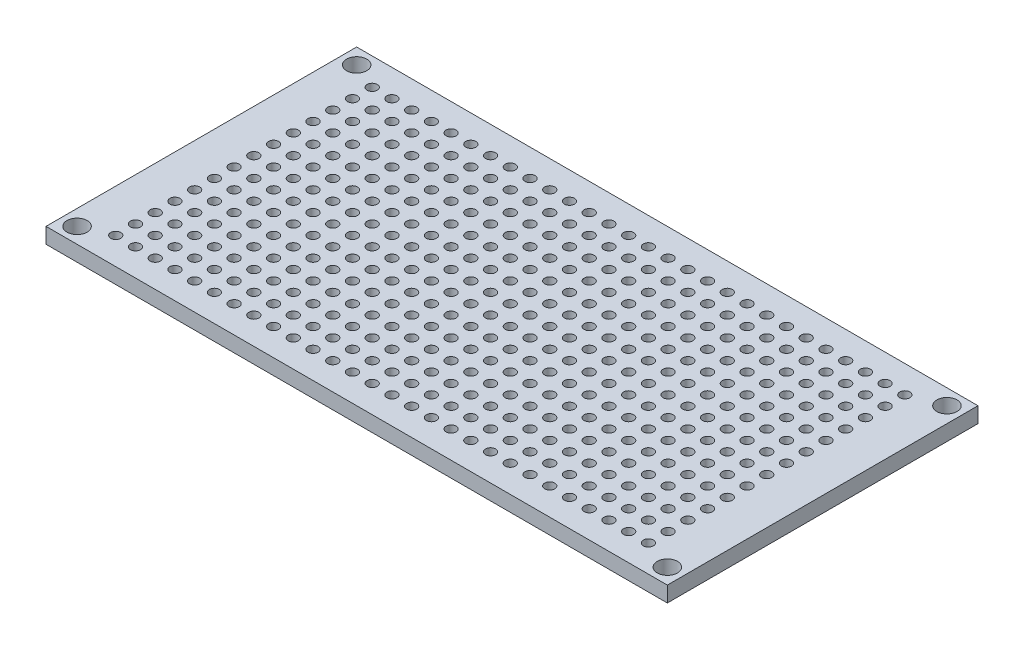
from build123d import *

# Parameters (mm, degrees)
SKETCH_1_W                 = 80
SKETCH_1_H                 = 40
EXTRUDE_1_DEPTH            = 2
HOLE_WIZARD_M21_D          = 2.6
HOLE_WIZARD_M11_D          = 1.3
PATTERN_LINEAR_1_OUTLINE_R = 0.65
PATTERN_LINEAR_1_DEPTH     = 2


# Read off the part's stored shape, not the designer's step: Линейный массив1
with BuildPart() as part:
    # Эскиз1 → Бобышка-Вытянуть1 (new body)
    with BuildSketch(Plane(origin=(0, 0, 0), x_dir=(1, 0, 0), z_dir=(0, 1, 0))):
        Rectangle(SKETCH_1_W, SKETCH_1_H)
    extrude(amount=EXTRUDE_1_DEPTH)

    # Отверстие с зазором M21 (through all)
    with Locations(Plane(origin=(0, 2, 0), x_dir=(1, 0, 0), z_dir=(0, 1, 0))):
        with Locations((-38, 18), (38, 18), (38, -18), (-38, -18)):
            Hole(HOLE_WIZARD_M21_D / 2)

    # Отверстие с зазором M11 (through all)
    with Locations(Plane(origin=(0, 2, 0), x_dir=(1, 0, 0), z_dir=(0, 1, 0))):
        with Locations((-34.5, 16.5)):
            Hole(HOLE_WIZARD_M11_D / 2)

    # Линейный массив1 outline → Линейный массив1 (cut)
    with BuildSketch(Plane(origin=(0, 0, 0), x_dir=(1, 0, 0), z_dir=(0, 1, 0))):
        with Locations((34.08, -16.52)):
            Circle(PATTERN_LINEAR_1_OUTLINE_R)
        with Locations((31.54, -16.52)):
            Circle(PATTERN_LINEAR_1_OUTLINE_R)
        with Locations((29, -16.52)):
            Circle(PATTERN_LINEAR_1_OUTLINE_R)
        with Locations((26.46, -16.52)):
            Circle(PATTERN_LINEAR_1_OUTLINE_R)
        with Locations((23.92, -16.52)):
            Circle(PATTERN_LINEAR_1_OUTLINE_R)
        with Locations((21.38, -16.52)):
            Circle(PATTERN_LINEAR_1_OUTLINE_R)
        with Locations((18.84, -16.52)):
            Circle(PATTERN_LINEAR_1_OUTLINE_R)
        with Locations((16.3, -16.52)):
            Circle(PATTERN_LINEAR_1_OUTLINE_R)
        with Locations((13.76, -16.52)):
            Circle(PATTERN_LINEAR_1_OUTLINE_R)
        with Locations((11.22, -16.52)):
            Circle(PATTERN_LINEAR_1_OUTLINE_R)
        with Locations((8.68, -16.52)):
            Circle(PATTERN_LINEAR_1_OUTLINE_R)
        with Locations((6.14, -16.52)):
            Circle(PATTERN_LINEAR_1_OUTLINE_R)
        with Locations((3.6, -16.52)):
            Circle(PATTERN_LINEAR_1_OUTLINE_R)
        with Locations((1.06, -16.52)):
            Circle(PATTERN_LINEAR_1_OUTLINE_R)
        with Locations((-1.48, -16.52)):
            Circle(PATTERN_LINEAR_1_OUTLINE_R)
        with Locations((-4.02, -16.52)):
            Circle(PATTERN_LINEAR_1_OUTLINE_R)
        with Locations((-6.56, -16.52)):
            Circle(PATTERN_LINEAR_1_OUTLINE_R)
        with Locations((-9.1, -16.52)):
            Circle(PATTERN_LINEAR_1_OUTLINE_R)
        with Locations((-11.64, -16.52)):
            Circle(PATTERN_LINEAR_1_OUTLINE_R)
        with Locations((-14.18, -16.52)):
            Circle(PATTERN_LINEAR_1_OUTLINE_R)
        with Locations((-16.72, -16.52)):
            Circle(PATTERN_LINEAR_1_OUTLINE_R)
        with Locations((-19.26, -16.52)):
            Circle(PATTERN_LINEAR_1_OUTLINE_R)
        with Locations((-21.8, -16.52)):
            Circle(PATTERN_LINEAR_1_OUTLINE_R)
        with Locations((-24.34, -16.52)):
            Circle(PATTERN_LINEAR_1_OUTLINE_R)
        with Locations((-26.88, -16.52)):
            Circle(PATTERN_LINEAR_1_OUTLINE_R)
        with Locations((-29.42, -16.52)):
            Circle(PATTERN_LINEAR_1_OUTLINE_R)
        with Locations((-31.96, -16.52)):
            Circle(PATTERN_LINEAR_1_OUTLINE_R)
        with Locations((-34.5, -16.52)):
            Circle(PATTERN_LINEAR_1_OUTLINE_R)
        with Locations((34.08, -13.98)):
            Circle(PATTERN_LINEAR_1_OUTLINE_R)
        with Locations((-34.5, -13.98)):
            Circle(PATTERN_LINEAR_1_OUTLINE_R)
        with Locations((34.08, -11.44)):
            Circle(PATTERN_LINEAR_1_OUTLINE_R)
        with Locations((-34.5, -11.44)):
            Circle(PATTERN_LINEAR_1_OUTLINE_R)
        with Locations((34.08, -8.9)):
            Circle(PATTERN_LINEAR_1_OUTLINE_R)
        with Locations((-34.5, -8.9)):
            Circle(PATTERN_LINEAR_1_OUTLINE_R)
        with Locations((34.08, -6.36)):
            Circle(PATTERN_LINEAR_1_OUTLINE_R)
        with Locations((-34.5, -6.36)):
            Circle(PATTERN_LINEAR_1_OUTLINE_R)
        with Locations((34.08, -3.82)):
            Circle(PATTERN_LINEAR_1_OUTLINE_R)
        with Locations((-34.5, -3.82)):
            Circle(PATTERN_LINEAR_1_OUTLINE_R)
        with Locations((34.08, -1.28)):
            Circle(PATTERN_LINEAR_1_OUTLINE_R)
        with Locations((-34.5, -1.28)):
            Circle(PATTERN_LINEAR_1_OUTLINE_R)
        with Locations((34.08, 1.26)):
            Circle(PATTERN_LINEAR_1_OUTLINE_R)
        with Locations((-34.5, 1.26)):
            Circle(PATTERN_LINEAR_1_OUTLINE_R)
        with Locations((34.08, 3.8)):
            Circle(PATTERN_LINEAR_1_OUTLINE_R)
        with Locations((-34.5, 3.8)):
            Circle(PATTERN_LINEAR_1_OUTLINE_R)
        with Locations((34.08, 6.34)):
            Circle(PATTERN_LINEAR_1_OUTLINE_R)
        with Locations((-34.5, 6.34)):
            Circle(PATTERN_LINEAR_1_OUTLINE_R)
        with Locations((34.08, 8.88)):
            Circle(PATTERN_LINEAR_1_OUTLINE_R)
        with Locations((-34.5, 8.88)):
            Circle(PATTERN_LINEAR_1_OUTLINE_R)
        with Locations((34.08, 11.42)):
            Circle(PATTERN_LINEAR_1_OUTLINE_R)
        with Locations((-34.5, 11.42)):
            Circle(PATTERN_LINEAR_1_OUTLINE_R)
        with Locations((34.08, 13.96)):
            Circle(PATTERN_LINEAR_1_OUTLINE_R)
        with Locations((-34.5, 13.96)):
            Circle(PATTERN_LINEAR_1_OUTLINE_R)
        with Locations((34.08, 16.5)):
            Circle(PATTERN_LINEAR_1_OUTLINE_R)
        with Locations((31.54, 16.5)):
            Circle(PATTERN_LINEAR_1_OUTLINE_R)
        with Locations((29, 16.5)):
            Circle(PATTERN_LINEAR_1_OUTLINE_R)
        with Locations((26.46, 16.5)):
            Circle(PATTERN_LINEAR_1_OUTLINE_R)
        with Locations((23.92, 16.5)):
            Circle(PATTERN_LINEAR_1_OUTLINE_R)
        with Locations((21.38, 16.5)):
            Circle(PATTERN_LINEAR_1_OUTLINE_R)
        with Locations((18.84, 16.5)):
            Circle(PATTERN_LINEAR_1_OUTLINE_R)
        with Locations((16.3, 16.5)):
            Circle(PATTERN_LINEAR_1_OUTLINE_R)
        with Locations((13.76, 16.5)):
            Circle(PATTERN_LINEAR_1_OUTLINE_R)
        with Locations((11.22, 16.5)):
            Circle(PATTERN_LINEAR_1_OUTLINE_R)
        with Locations((8.68, 16.5)):
            Circle(PATTERN_LINEAR_1_OUTLINE_R)
        with Locations((6.14, 16.5)):
            Circle(PATTERN_LINEAR_1_OUTLINE_R)
        with Locations((3.6, 16.5)):
            Circle(PATTERN_LINEAR_1_OUTLINE_R)
        with Locations((1.06, 16.5)):
            Circle(PATTERN_LINEAR_1_OUTLINE_R)
        with Locations((-1.48, 16.5)):
            Circle(PATTERN_LINEAR_1_OUTLINE_R)
        with Locations((-4.02, 16.5)):
            Circle(PATTERN_LINEAR_1_OUTLINE_R)
        with Locations((-6.56, 16.5)):
            Circle(PATTERN_LINEAR_1_OUTLINE_R)
        with Locations((-9.1, 16.5)):
            Circle(PATTERN_LINEAR_1_OUTLINE_R)
        with Locations((-11.64, 16.5)):
            Circle(PATTERN_LINEAR_1_OUTLINE_R)
        with Locations((-14.18, 16.5)):
            Circle(PATTERN_LINEAR_1_OUTLINE_R)
        with Locations((-16.72, 16.5)):
            Circle(PATTERN_LINEAR_1_OUTLINE_R)
        with Locations((-19.26, 16.5)):
            Circle(PATTERN_LINEAR_1_OUTLINE_R)
        with Locations((-21.8, 16.5)):
            Circle(PATTERN_LINEAR_1_OUTLINE_R)
        with Locations((-24.34, 16.5)):
            Circle(PATTERN_LINEAR_1_OUTLINE_R)
        with Locations((-26.88, 16.5)):
            Circle(PATTERN_LINEAR_1_OUTLINE_R)
        with Locations((-29.42, 16.5)):
            Circle(PATTERN_LINEAR_1_OUTLINE_R)
        with Locations((31.54, -13.98)):
            Circle(PATTERN_LINEAR_1_OUTLINE_R)
        with Locations((29, -13.98)):
            Circle(PATTERN_LINEAR_1_OUTLINE_R)
        with Locations((26.46, -13.98)):
            Circle(PATTERN_LINEAR_1_OUTLINE_R)
        with Locations((23.92, -13.98)):
            Circle(PATTERN_LINEAR_1_OUTLINE_R)
        with Locations((21.38, -13.98)):
            Circle(PATTERN_LINEAR_1_OUTLINE_R)
        with Locations((18.84, -13.98)):
            Circle(PATTERN_LINEAR_1_OUTLINE_R)
        with Locations((16.3, -13.98)):
            Circle(PATTERN_LINEAR_1_OUTLINE_R)
        with Locations((13.76, -13.98)):
            Circle(PATTERN_LINEAR_1_OUTLINE_R)
        with Locations((11.22, -13.98)):
            Circle(PATTERN_LINEAR_1_OUTLINE_R)
        with Locations((8.68, -13.98)):
            Circle(PATTERN_LINEAR_1_OUTLINE_R)
        with Locations((6.14, -13.98)):
            Circle(PATTERN_LINEAR_1_OUTLINE_R)
        with Locations((3.6, -13.98)):
            Circle(PATTERN_LINEAR_1_OUTLINE_R)
        with Locations((1.06, -13.98)):
            Circle(PATTERN_LINEAR_1_OUTLINE_R)
        with Locations((-1.48, -13.98)):
            Circle(PATTERN_LINEAR_1_OUTLINE_R)
        with Locations((-4.02, -13.98)):
            Circle(PATTERN_LINEAR_1_OUTLINE_R)
        with Locations((-6.56, -13.98)):
            Circle(PATTERN_LINEAR_1_OUTLINE_R)
        with Locations((-9.1, -13.98)):
            Circle(PATTERN_LINEAR_1_OUTLINE_R)
        with Locations((-11.64, -13.98)):
            Circle(PATTERN_LINEAR_1_OUTLINE_R)
        with Locations((-14.18, -13.98)):
            Circle(PATTERN_LINEAR_1_OUTLINE_R)
        with Locations((-16.72, -13.98)):
            Circle(PATTERN_LINEAR_1_OUTLINE_R)
        with Locations((-19.26, -13.98)):
            Circle(PATTERN_LINEAR_1_OUTLINE_R)
        with Locations((-21.8, -13.98)):
            Circle(PATTERN_LINEAR_1_OUTLINE_R)
        with Locations((-24.34, -13.98)):
            Circle(PATTERN_LINEAR_1_OUTLINE_R)
        with Locations((-26.88, -13.98)):
            Circle(PATTERN_LINEAR_1_OUTLINE_R)
        with Locations((-29.42, -13.98)):
            Circle(PATTERN_LINEAR_1_OUTLINE_R)
        with Locations((-31.96, -13.98)):
            Circle(PATTERN_LINEAR_1_OUTLINE_R)
        with Locations((31.54, -11.44)):
            Circle(PATTERN_LINEAR_1_OUTLINE_R)
        with Locations((29, -11.44)):
            Circle(PATTERN_LINEAR_1_OUTLINE_R)
        with Locations((26.46, -11.44)):
            Circle(PATTERN_LINEAR_1_OUTLINE_R)
        with Locations((23.92, -11.44)):
            Circle(PATTERN_LINEAR_1_OUTLINE_R)
        with Locations((21.38, -11.44)):
            Circle(PATTERN_LINEAR_1_OUTLINE_R)
        with Locations((18.84, -11.44)):
            Circle(PATTERN_LINEAR_1_OUTLINE_R)
        with Locations((16.3, -11.44)):
            Circle(PATTERN_LINEAR_1_OUTLINE_R)
        with Locations((13.76, -11.44)):
            Circle(PATTERN_LINEAR_1_OUTLINE_R)
        with Locations((11.22, -11.44)):
            Circle(PATTERN_LINEAR_1_OUTLINE_R)
        with Locations((8.68, -11.44)):
            Circle(PATTERN_LINEAR_1_OUTLINE_R)
        with Locations((6.14, -11.44)):
            Circle(PATTERN_LINEAR_1_OUTLINE_R)
        with Locations((3.6, -11.44)):
            Circle(PATTERN_LINEAR_1_OUTLINE_R)
        with Locations((1.06, -11.44)):
            Circle(PATTERN_LINEAR_1_OUTLINE_R)
        with Locations((-1.48, -11.44)):
            Circle(PATTERN_LINEAR_1_OUTLINE_R)
        with Locations((-4.02, -11.44)):
            Circle(PATTERN_LINEAR_1_OUTLINE_R)
        with Locations((-6.56, -11.44)):
            Circle(PATTERN_LINEAR_1_OUTLINE_R)
        with Locations((-9.1, -11.44)):
            Circle(PATTERN_LINEAR_1_OUTLINE_R)
        with Locations((-11.64, -11.44)):
            Circle(PATTERN_LINEAR_1_OUTLINE_R)
        with Locations((-14.18, -11.44)):
            Circle(PATTERN_LINEAR_1_OUTLINE_R)
        with Locations((-16.72, -11.44)):
            Circle(PATTERN_LINEAR_1_OUTLINE_R)
        with Locations((-19.26, -11.44)):
            Circle(PATTERN_LINEAR_1_OUTLINE_R)
        with Locations((-21.8, -11.44)):
            Circle(PATTERN_LINEAR_1_OUTLINE_R)
        with Locations((-24.34, -11.44)):
            Circle(PATTERN_LINEAR_1_OUTLINE_R)
        with Locations((-26.88, -11.44)):
            Circle(PATTERN_LINEAR_1_OUTLINE_R)
        with Locations((-29.42, -11.44)):
            Circle(PATTERN_LINEAR_1_OUTLINE_R)
        with Locations((-31.96, -11.44)):
            Circle(PATTERN_LINEAR_1_OUTLINE_R)
        with Locations((31.54, -8.9)):
            Circle(PATTERN_LINEAR_1_OUTLINE_R)
        with Locations((29, -8.9)):
            Circle(PATTERN_LINEAR_1_OUTLINE_R)
        with Locations((26.46, -8.9)):
            Circle(PATTERN_LINEAR_1_OUTLINE_R)
        with Locations((23.92, -8.9)):
            Circle(PATTERN_LINEAR_1_OUTLINE_R)
        with Locations((21.38, -8.9)):
            Circle(PATTERN_LINEAR_1_OUTLINE_R)
        with Locations((18.84, -8.9)):
            Circle(PATTERN_LINEAR_1_OUTLINE_R)
        with Locations((16.3, -8.9)):
            Circle(PATTERN_LINEAR_1_OUTLINE_R)
        with Locations((13.76, -8.9)):
            Circle(PATTERN_LINEAR_1_OUTLINE_R)
        with Locations((11.22, -8.9)):
            Circle(PATTERN_LINEAR_1_OUTLINE_R)
        with Locations((8.68, -8.9)):
            Circle(PATTERN_LINEAR_1_OUTLINE_R)
        with Locations((6.14, -8.9)):
            Circle(PATTERN_LINEAR_1_OUTLINE_R)
        with Locations((3.6, -8.9)):
            Circle(PATTERN_LINEAR_1_OUTLINE_R)
        with Locations((1.06, -8.9)):
            Circle(PATTERN_LINEAR_1_OUTLINE_R)
        with Locations((-1.48, -8.9)):
            Circle(PATTERN_LINEAR_1_OUTLINE_R)
        with Locations((-4.02, -8.9)):
            Circle(PATTERN_LINEAR_1_OUTLINE_R)
        with Locations((-6.56, -8.9)):
            Circle(PATTERN_LINEAR_1_OUTLINE_R)
        with Locations((-9.1, -8.9)):
            Circle(PATTERN_LINEAR_1_OUTLINE_R)
        with Locations((-11.64, -8.9)):
            Circle(PATTERN_LINEAR_1_OUTLINE_R)
        with Locations((-14.18, -8.9)):
            Circle(PATTERN_LINEAR_1_OUTLINE_R)
        with Locations((-16.72, -8.9)):
            Circle(PATTERN_LINEAR_1_OUTLINE_R)
        with Locations((-19.26, -8.9)):
            Circle(PATTERN_LINEAR_1_OUTLINE_R)
        with Locations((-21.8, -8.9)):
            Circle(PATTERN_LINEAR_1_OUTLINE_R)
        with Locations((-24.34, -8.9)):
            Circle(PATTERN_LINEAR_1_OUTLINE_R)
        with Locations((-26.88, -8.9)):
            Circle(PATTERN_LINEAR_1_OUTLINE_R)
        with Locations((-29.42, -8.9)):
            Circle(PATTERN_LINEAR_1_OUTLINE_R)
        with Locations((-31.96, -8.9)):
            Circle(PATTERN_LINEAR_1_OUTLINE_R)
        with Locations((31.54, -6.36)):
            Circle(PATTERN_LINEAR_1_OUTLINE_R)
        with Locations((29, -6.36)):
            Circle(PATTERN_LINEAR_1_OUTLINE_R)
        with Locations((26.46, -6.36)):
            Circle(PATTERN_LINEAR_1_OUTLINE_R)
        with Locations((23.92, -6.36)):
            Circle(PATTERN_LINEAR_1_OUTLINE_R)
        with Locations((21.38, -6.36)):
            Circle(PATTERN_LINEAR_1_OUTLINE_R)
        with Locations((18.84, -6.36)):
            Circle(PATTERN_LINEAR_1_OUTLINE_R)
        with Locations((16.3, -6.36)):
            Circle(PATTERN_LINEAR_1_OUTLINE_R)
        with Locations((13.76, -6.36)):
            Circle(PATTERN_LINEAR_1_OUTLINE_R)
        with Locations((11.22, -6.36)):
            Circle(PATTERN_LINEAR_1_OUTLINE_R)
        with Locations((8.68, -6.36)):
            Circle(PATTERN_LINEAR_1_OUTLINE_R)
        with Locations((6.14, -6.36)):
            Circle(PATTERN_LINEAR_1_OUTLINE_R)
        with Locations((3.6, -6.36)):
            Circle(PATTERN_LINEAR_1_OUTLINE_R)
        with Locations((1.06, -6.36)):
            Circle(PATTERN_LINEAR_1_OUTLINE_R)
        with Locations((-1.48, -6.36)):
            Circle(PATTERN_LINEAR_1_OUTLINE_R)
        with Locations((-4.02, -6.36)):
            Circle(PATTERN_LINEAR_1_OUTLINE_R)
        with Locations((-6.56, -6.36)):
            Circle(PATTERN_LINEAR_1_OUTLINE_R)
        with Locations((-9.1, -6.36)):
            Circle(PATTERN_LINEAR_1_OUTLINE_R)
        with Locations((-11.64, -6.36)):
            Circle(PATTERN_LINEAR_1_OUTLINE_R)
        with Locations((-14.18, -6.36)):
            Circle(PATTERN_LINEAR_1_OUTLINE_R)
        with Locations((-16.72, -6.36)):
            Circle(PATTERN_LINEAR_1_OUTLINE_R)
        with Locations((-19.26, -6.36)):
            Circle(PATTERN_LINEAR_1_OUTLINE_R)
        with Locations((-21.8, -6.36)):
            Circle(PATTERN_LINEAR_1_OUTLINE_R)
        with Locations((-24.34, -6.36)):
            Circle(PATTERN_LINEAR_1_OUTLINE_R)
        with Locations((-26.88, -6.36)):
            Circle(PATTERN_LINEAR_1_OUTLINE_R)
        with Locations((-29.42, -6.36)):
            Circle(PATTERN_LINEAR_1_OUTLINE_R)
        with Locations((-31.96, -6.36)):
            Circle(PATTERN_LINEAR_1_OUTLINE_R)
        with Locations((31.54, -3.82)):
            Circle(PATTERN_LINEAR_1_OUTLINE_R)
        with Locations((29, -3.82)):
            Circle(PATTERN_LINEAR_1_OUTLINE_R)
        with Locations((26.46, -3.82)):
            Circle(PATTERN_LINEAR_1_OUTLINE_R)
        with Locations((23.92, -3.82)):
            Circle(PATTERN_LINEAR_1_OUTLINE_R)
        with Locations((21.38, -3.82)):
            Circle(PATTERN_LINEAR_1_OUTLINE_R)
        with Locations((18.84, -3.82)):
            Circle(PATTERN_LINEAR_1_OUTLINE_R)
        with Locations((16.3, -3.82)):
            Circle(PATTERN_LINEAR_1_OUTLINE_R)
        with Locations((13.76, -3.82)):
            Circle(PATTERN_LINEAR_1_OUTLINE_R)
        with Locations((11.22, -3.82)):
            Circle(PATTERN_LINEAR_1_OUTLINE_R)
        with Locations((8.68, -3.82)):
            Circle(PATTERN_LINEAR_1_OUTLINE_R)
        with Locations((6.14, -3.82)):
            Circle(PATTERN_LINEAR_1_OUTLINE_R)
        with Locations((3.6, -3.82)):
            Circle(PATTERN_LINEAR_1_OUTLINE_R)
        with Locations((1.06, -3.82)):
            Circle(PATTERN_LINEAR_1_OUTLINE_R)
        with Locations((-1.48, -3.82)):
            Circle(PATTERN_LINEAR_1_OUTLINE_R)
        with Locations((-4.02, -3.82)):
            Circle(PATTERN_LINEAR_1_OUTLINE_R)
        with Locations((-6.56, -3.82)):
            Circle(PATTERN_LINEAR_1_OUTLINE_R)
        with Locations((-9.1, -3.82)):
            Circle(PATTERN_LINEAR_1_OUTLINE_R)
        with Locations((-11.64, -3.82)):
            Circle(PATTERN_LINEAR_1_OUTLINE_R)
        with Locations((-14.18, -3.82)):
            Circle(PATTERN_LINEAR_1_OUTLINE_R)
        with Locations((-16.72, -3.82)):
            Circle(PATTERN_LINEAR_1_OUTLINE_R)
        with Locations((-19.26, -3.82)):
            Circle(PATTERN_LINEAR_1_OUTLINE_R)
        with Locations((-21.8, -3.82)):
            Circle(PATTERN_LINEAR_1_OUTLINE_R)
        with Locations((-24.34, -3.82)):
            Circle(PATTERN_LINEAR_1_OUTLINE_R)
        with Locations((-26.88, -3.82)):
            Circle(PATTERN_LINEAR_1_OUTLINE_R)
        with Locations((-29.42, -3.82)):
            Circle(PATTERN_LINEAR_1_OUTLINE_R)
        with Locations((-31.96, -3.82)):
            Circle(PATTERN_LINEAR_1_OUTLINE_R)
        with Locations((31.54, -1.28)):
            Circle(PATTERN_LINEAR_1_OUTLINE_R)
        with Locations((29, -1.28)):
            Circle(PATTERN_LINEAR_1_OUTLINE_R)
        with Locations((26.46, -1.28)):
            Circle(PATTERN_LINEAR_1_OUTLINE_R)
        with Locations((23.92, -1.28)):
            Circle(PATTERN_LINEAR_1_OUTLINE_R)
        with Locations((21.38, -1.28)):
            Circle(PATTERN_LINEAR_1_OUTLINE_R)
        with Locations((18.84, -1.28)):
            Circle(PATTERN_LINEAR_1_OUTLINE_R)
        with Locations((16.3, -1.28)):
            Circle(PATTERN_LINEAR_1_OUTLINE_R)
        with Locations((13.76, -1.28)):
            Circle(PATTERN_LINEAR_1_OUTLINE_R)
        with Locations((11.22, -1.28)):
            Circle(PATTERN_LINEAR_1_OUTLINE_R)
        with Locations((8.68, -1.28)):
            Circle(PATTERN_LINEAR_1_OUTLINE_R)
        with Locations((6.14, -1.28)):
            Circle(PATTERN_LINEAR_1_OUTLINE_R)
        with Locations((3.6, -1.28)):
            Circle(PATTERN_LINEAR_1_OUTLINE_R)
        with Locations((1.06, -1.28)):
            Circle(PATTERN_LINEAR_1_OUTLINE_R)
        with Locations((-1.48, -1.28)):
            Circle(PATTERN_LINEAR_1_OUTLINE_R)
        with Locations((-4.02, -1.28)):
            Circle(PATTERN_LINEAR_1_OUTLINE_R)
        with Locations((-6.56, -1.28)):
            Circle(PATTERN_LINEAR_1_OUTLINE_R)
        with Locations((-9.1, -1.28)):
            Circle(PATTERN_LINEAR_1_OUTLINE_R)
        with Locations((-11.64, -1.28)):
            Circle(PATTERN_LINEAR_1_OUTLINE_R)
        with Locations((-14.18, -1.28)):
            Circle(PATTERN_LINEAR_1_OUTLINE_R)
        with Locations((-16.72, -1.28)):
            Circle(PATTERN_LINEAR_1_OUTLINE_R)
        with Locations((-19.26, -1.28)):
            Circle(PATTERN_LINEAR_1_OUTLINE_R)
        with Locations((-21.8, -1.28)):
            Circle(PATTERN_LINEAR_1_OUTLINE_R)
        with Locations((-24.34, -1.28)):
            Circle(PATTERN_LINEAR_1_OUTLINE_R)
        with Locations((-26.88, -1.28)):
            Circle(PATTERN_LINEAR_1_OUTLINE_R)
        with Locations((-29.42, -1.28)):
            Circle(PATTERN_LINEAR_1_OUTLINE_R)
        with Locations((-31.96, -1.28)):
            Circle(PATTERN_LINEAR_1_OUTLINE_R)
        with Locations((31.54, 1.26)):
            Circle(PATTERN_LINEAR_1_OUTLINE_R)
        with Locations((29, 1.26)):
            Circle(PATTERN_LINEAR_1_OUTLINE_R)
        with Locations((26.46, 1.26)):
            Circle(PATTERN_LINEAR_1_OUTLINE_R)
        with Locations((23.92, 1.26)):
            Circle(PATTERN_LINEAR_1_OUTLINE_R)
        with Locations((21.38, 1.26)):
            Circle(PATTERN_LINEAR_1_OUTLINE_R)
        with Locations((18.84, 1.26)):
            Circle(PATTERN_LINEAR_1_OUTLINE_R)
        with Locations((16.3, 1.26)):
            Circle(PATTERN_LINEAR_1_OUTLINE_R)
        with Locations((13.76, 1.26)):
            Circle(PATTERN_LINEAR_1_OUTLINE_R)
        with Locations((11.22, 1.26)):
            Circle(PATTERN_LINEAR_1_OUTLINE_R)
        with Locations((8.68, 1.26)):
            Circle(PATTERN_LINEAR_1_OUTLINE_R)
        with Locations((6.14, 1.26)):
            Circle(PATTERN_LINEAR_1_OUTLINE_R)
        with Locations((3.6, 1.26)):
            Circle(PATTERN_LINEAR_1_OUTLINE_R)
        with Locations((1.06, 1.26)):
            Circle(PATTERN_LINEAR_1_OUTLINE_R)
        with Locations((-1.48, 1.26)):
            Circle(PATTERN_LINEAR_1_OUTLINE_R)
        with Locations((-4.02, 1.26)):
            Circle(PATTERN_LINEAR_1_OUTLINE_R)
        with Locations((-6.56, 1.26)):
            Circle(PATTERN_LINEAR_1_OUTLINE_R)
        with Locations((-9.1, 1.26)):
            Circle(PATTERN_LINEAR_1_OUTLINE_R)
        with Locations((-11.64, 1.26)):
            Circle(PATTERN_LINEAR_1_OUTLINE_R)
        with Locations((-14.18, 1.26)):
            Circle(PATTERN_LINEAR_1_OUTLINE_R)
        with Locations((-16.72, 1.26)):
            Circle(PATTERN_LINEAR_1_OUTLINE_R)
        with Locations((-19.26, 1.26)):
            Circle(PATTERN_LINEAR_1_OUTLINE_R)
        with Locations((-21.8, 1.26)):
            Circle(PATTERN_LINEAR_1_OUTLINE_R)
        with Locations((-24.34, 1.26)):
            Circle(PATTERN_LINEAR_1_OUTLINE_R)
        with Locations((-26.88, 1.26)):
            Circle(PATTERN_LINEAR_1_OUTLINE_R)
        with Locations((-29.42, 1.26)):
            Circle(PATTERN_LINEAR_1_OUTLINE_R)
        with Locations((-31.96, 1.26)):
            Circle(PATTERN_LINEAR_1_OUTLINE_R)
        with Locations((31.54, 3.8)):
            Circle(PATTERN_LINEAR_1_OUTLINE_R)
        with Locations((29, 3.8)):
            Circle(PATTERN_LINEAR_1_OUTLINE_R)
        with Locations((26.46, 3.8)):
            Circle(PATTERN_LINEAR_1_OUTLINE_R)
        with Locations((23.92, 3.8)):
            Circle(PATTERN_LINEAR_1_OUTLINE_R)
        with Locations((21.38, 3.8)):
            Circle(PATTERN_LINEAR_1_OUTLINE_R)
        with Locations((18.84, 3.8)):
            Circle(PATTERN_LINEAR_1_OUTLINE_R)
        with Locations((16.3, 3.8)):
            Circle(PATTERN_LINEAR_1_OUTLINE_R)
        with Locations((13.76, 3.8)):
            Circle(PATTERN_LINEAR_1_OUTLINE_R)
        with Locations((11.22, 3.8)):
            Circle(PATTERN_LINEAR_1_OUTLINE_R)
        with Locations((8.68, 3.8)):
            Circle(PATTERN_LINEAR_1_OUTLINE_R)
        with Locations((6.14, 3.8)):
            Circle(PATTERN_LINEAR_1_OUTLINE_R)
        with Locations((3.6, 3.8)):
            Circle(PATTERN_LINEAR_1_OUTLINE_R)
        with Locations((1.06, 3.8)):
            Circle(PATTERN_LINEAR_1_OUTLINE_R)
        with Locations((-1.48, 3.8)):
            Circle(PATTERN_LINEAR_1_OUTLINE_R)
        with Locations((-4.02, 3.8)):
            Circle(PATTERN_LINEAR_1_OUTLINE_R)
        with Locations((-6.56, 3.8)):
            Circle(PATTERN_LINEAR_1_OUTLINE_R)
        with Locations((-9.1, 3.8)):
            Circle(PATTERN_LINEAR_1_OUTLINE_R)
        with Locations((-11.64, 3.8)):
            Circle(PATTERN_LINEAR_1_OUTLINE_R)
        with Locations((-14.18, 3.8)):
            Circle(PATTERN_LINEAR_1_OUTLINE_R)
        with Locations((-16.72, 3.8)):
            Circle(PATTERN_LINEAR_1_OUTLINE_R)
        with Locations((-19.26, 3.8)):
            Circle(PATTERN_LINEAR_1_OUTLINE_R)
        with Locations((-21.8, 3.8)):
            Circle(PATTERN_LINEAR_1_OUTLINE_R)
        with Locations((-24.34, 3.8)):
            Circle(PATTERN_LINEAR_1_OUTLINE_R)
        with Locations((-26.88, 3.8)):
            Circle(PATTERN_LINEAR_1_OUTLINE_R)
        with Locations((-29.42, 3.8)):
            Circle(PATTERN_LINEAR_1_OUTLINE_R)
        with Locations((-31.96, 3.8)):
            Circle(PATTERN_LINEAR_1_OUTLINE_R)
        with Locations((31.54, 6.34)):
            Circle(PATTERN_LINEAR_1_OUTLINE_R)
        with Locations((29, 6.34)):
            Circle(PATTERN_LINEAR_1_OUTLINE_R)
        with Locations((26.46, 6.34)):
            Circle(PATTERN_LINEAR_1_OUTLINE_R)
        with Locations((23.92, 6.34)):
            Circle(PATTERN_LINEAR_1_OUTLINE_R)
        with Locations((21.38, 6.34)):
            Circle(PATTERN_LINEAR_1_OUTLINE_R)
        with Locations((18.84, 6.34)):
            Circle(PATTERN_LINEAR_1_OUTLINE_R)
        with Locations((16.3, 6.34)):
            Circle(PATTERN_LINEAR_1_OUTLINE_R)
        with Locations((13.76, 6.34)):
            Circle(PATTERN_LINEAR_1_OUTLINE_R)
        with Locations((11.22, 6.34)):
            Circle(PATTERN_LINEAR_1_OUTLINE_R)
        with Locations((8.68, 6.34)):
            Circle(PATTERN_LINEAR_1_OUTLINE_R)
        with Locations((6.14, 6.34)):
            Circle(PATTERN_LINEAR_1_OUTLINE_R)
        with Locations((3.6, 6.34)):
            Circle(PATTERN_LINEAR_1_OUTLINE_R)
        with Locations((1.06, 6.34)):
            Circle(PATTERN_LINEAR_1_OUTLINE_R)
        with Locations((-1.48, 6.34)):
            Circle(PATTERN_LINEAR_1_OUTLINE_R)
        with Locations((-4.02, 6.34)):
            Circle(PATTERN_LINEAR_1_OUTLINE_R)
        with Locations((-6.56, 6.34)):
            Circle(PATTERN_LINEAR_1_OUTLINE_R)
        with Locations((-9.1, 6.34)):
            Circle(PATTERN_LINEAR_1_OUTLINE_R)
        with Locations((-11.64, 6.34)):
            Circle(PATTERN_LINEAR_1_OUTLINE_R)
        with Locations((-14.18, 6.34)):
            Circle(PATTERN_LINEAR_1_OUTLINE_R)
        with Locations((-16.72, 6.34)):
            Circle(PATTERN_LINEAR_1_OUTLINE_R)
        with Locations((-19.26, 6.34)):
            Circle(PATTERN_LINEAR_1_OUTLINE_R)
        with Locations((-21.8, 6.34)):
            Circle(PATTERN_LINEAR_1_OUTLINE_R)
        with Locations((-24.34, 6.34)):
            Circle(PATTERN_LINEAR_1_OUTLINE_R)
        with Locations((-26.88, 6.34)):
            Circle(PATTERN_LINEAR_1_OUTLINE_R)
        with Locations((-29.42, 6.34)):
            Circle(PATTERN_LINEAR_1_OUTLINE_R)
        with Locations((-31.96, 6.34)):
            Circle(PATTERN_LINEAR_1_OUTLINE_R)
        with Locations((31.54, 8.88)):
            Circle(PATTERN_LINEAR_1_OUTLINE_R)
        with Locations((29, 8.88)):
            Circle(PATTERN_LINEAR_1_OUTLINE_R)
        with Locations((26.46, 8.88)):
            Circle(PATTERN_LINEAR_1_OUTLINE_R)
        with Locations((23.92, 8.88)):
            Circle(PATTERN_LINEAR_1_OUTLINE_R)
        with Locations((21.38, 8.88)):
            Circle(PATTERN_LINEAR_1_OUTLINE_R)
        with Locations((18.84, 8.88)):
            Circle(PATTERN_LINEAR_1_OUTLINE_R)
        with Locations((16.3, 8.88)):
            Circle(PATTERN_LINEAR_1_OUTLINE_R)
        with Locations((13.76, 8.88)):
            Circle(PATTERN_LINEAR_1_OUTLINE_R)
        with Locations((11.22, 8.88)):
            Circle(PATTERN_LINEAR_1_OUTLINE_R)
        with Locations((8.68, 8.88)):
            Circle(PATTERN_LINEAR_1_OUTLINE_R)
        with Locations((6.14, 8.88)):
            Circle(PATTERN_LINEAR_1_OUTLINE_R)
        with Locations((3.6, 8.88)):
            Circle(PATTERN_LINEAR_1_OUTLINE_R)
        with Locations((1.06, 8.88)):
            Circle(PATTERN_LINEAR_1_OUTLINE_R)
        with Locations((-1.48, 8.88)):
            Circle(PATTERN_LINEAR_1_OUTLINE_R)
        with Locations((-4.02, 8.88)):
            Circle(PATTERN_LINEAR_1_OUTLINE_R)
        with Locations((-6.56, 8.88)):
            Circle(PATTERN_LINEAR_1_OUTLINE_R)
        with Locations((-9.1, 8.88)):
            Circle(PATTERN_LINEAR_1_OUTLINE_R)
        with Locations((-11.64, 8.88)):
            Circle(PATTERN_LINEAR_1_OUTLINE_R)
        with Locations((-14.18, 8.88)):
            Circle(PATTERN_LINEAR_1_OUTLINE_R)
        with Locations((-16.72, 8.88)):
            Circle(PATTERN_LINEAR_1_OUTLINE_R)
        with Locations((-19.26, 8.88)):
            Circle(PATTERN_LINEAR_1_OUTLINE_R)
        with Locations((-21.8, 8.88)):
            Circle(PATTERN_LINEAR_1_OUTLINE_R)
        with Locations((-24.34, 8.88)):
            Circle(PATTERN_LINEAR_1_OUTLINE_R)
        with Locations((-26.88, 8.88)):
            Circle(PATTERN_LINEAR_1_OUTLINE_R)
        with Locations((-29.42, 8.88)):
            Circle(PATTERN_LINEAR_1_OUTLINE_R)
        with Locations((-31.96, 8.88)):
            Circle(PATTERN_LINEAR_1_OUTLINE_R)
        with Locations((31.54, 11.42)):
            Circle(PATTERN_LINEAR_1_OUTLINE_R)
        with Locations((29, 11.42)):
            Circle(PATTERN_LINEAR_1_OUTLINE_R)
        with Locations((26.46, 11.42)):
            Circle(PATTERN_LINEAR_1_OUTLINE_R)
        with Locations((23.92, 11.42)):
            Circle(PATTERN_LINEAR_1_OUTLINE_R)
        with Locations((21.38, 11.42)):
            Circle(PATTERN_LINEAR_1_OUTLINE_R)
        with Locations((18.84, 11.42)):
            Circle(PATTERN_LINEAR_1_OUTLINE_R)
        with Locations((16.3, 11.42)):
            Circle(PATTERN_LINEAR_1_OUTLINE_R)
        with Locations((13.76, 11.42)):
            Circle(PATTERN_LINEAR_1_OUTLINE_R)
        with Locations((11.22, 11.42)):
            Circle(PATTERN_LINEAR_1_OUTLINE_R)
        with Locations((8.68, 11.42)):
            Circle(PATTERN_LINEAR_1_OUTLINE_R)
        with Locations((6.14, 11.42)):
            Circle(PATTERN_LINEAR_1_OUTLINE_R)
        with Locations((3.6, 11.42)):
            Circle(PATTERN_LINEAR_1_OUTLINE_R)
        with Locations((1.06, 11.42)):
            Circle(PATTERN_LINEAR_1_OUTLINE_R)
        with Locations((-1.48, 11.42)):
            Circle(PATTERN_LINEAR_1_OUTLINE_R)
        with Locations((-4.02, 11.42)):
            Circle(PATTERN_LINEAR_1_OUTLINE_R)
        with Locations((-6.56, 11.42)):
            Circle(PATTERN_LINEAR_1_OUTLINE_R)
        with Locations((-9.1, 11.42)):
            Circle(PATTERN_LINEAR_1_OUTLINE_R)
        with Locations((-11.64, 11.42)):
            Circle(PATTERN_LINEAR_1_OUTLINE_R)
        with Locations((-14.18, 11.42)):
            Circle(PATTERN_LINEAR_1_OUTLINE_R)
        with Locations((-16.72, 11.42)):
            Circle(PATTERN_LINEAR_1_OUTLINE_R)
        with Locations((-19.26, 11.42)):
            Circle(PATTERN_LINEAR_1_OUTLINE_R)
        with Locations((-21.8, 11.42)):
            Circle(PATTERN_LINEAR_1_OUTLINE_R)
        with Locations((-24.34, 11.42)):
            Circle(PATTERN_LINEAR_1_OUTLINE_R)
        with Locations((-26.88, 11.42)):
            Circle(PATTERN_LINEAR_1_OUTLINE_R)
        with Locations((-29.42, 11.42)):
            Circle(PATTERN_LINEAR_1_OUTLINE_R)
        with Locations((-31.96, 11.42)):
            Circle(PATTERN_LINEAR_1_OUTLINE_R)
        with Locations((31.54, 13.96)):
            Circle(PATTERN_LINEAR_1_OUTLINE_R)
        with Locations((29, 13.96)):
            Circle(PATTERN_LINEAR_1_OUTLINE_R)
        with Locations((26.46, 13.96)):
            Circle(PATTERN_LINEAR_1_OUTLINE_R)
        with Locations((23.92, 13.96)):
            Circle(PATTERN_LINEAR_1_OUTLINE_R)
        with Locations((21.38, 13.96)):
            Circle(PATTERN_LINEAR_1_OUTLINE_R)
        with Locations((18.84, 13.96)):
            Circle(PATTERN_LINEAR_1_OUTLINE_R)
        with Locations((16.3, 13.96)):
            Circle(PATTERN_LINEAR_1_OUTLINE_R)
        with Locations((13.76, 13.96)):
            Circle(PATTERN_LINEAR_1_OUTLINE_R)
        with Locations((11.22, 13.96)):
            Circle(PATTERN_LINEAR_1_OUTLINE_R)
        with Locations((8.68, 13.96)):
            Circle(PATTERN_LINEAR_1_OUTLINE_R)
        with Locations((6.14, 13.96)):
            Circle(PATTERN_LINEAR_1_OUTLINE_R)
        with Locations((3.6, 13.96)):
            Circle(PATTERN_LINEAR_1_OUTLINE_R)
        with Locations((1.06, 13.96)):
            Circle(PATTERN_LINEAR_1_OUTLINE_R)
        with Locations((-1.48, 13.96)):
            Circle(PATTERN_LINEAR_1_OUTLINE_R)
        with Locations((-4.02, 13.96)):
            Circle(PATTERN_LINEAR_1_OUTLINE_R)
        with Locations((-6.56, 13.96)):
            Circle(PATTERN_LINEAR_1_OUTLINE_R)
        with Locations((-9.1, 13.96)):
            Circle(PATTERN_LINEAR_1_OUTLINE_R)
        with Locations((-11.64, 13.96)):
            Circle(PATTERN_LINEAR_1_OUTLINE_R)
        with Locations((-14.18, 13.96)):
            Circle(PATTERN_LINEAR_1_OUTLINE_R)
        with Locations((-16.72, 13.96)):
            Circle(PATTERN_LINEAR_1_OUTLINE_R)
        with Locations((-19.26, 13.96)):
            Circle(PATTERN_LINEAR_1_OUTLINE_R)
        with Locations((-21.8, 13.96)):
            Circle(PATTERN_LINEAR_1_OUTLINE_R)
        with Locations((-24.34, 13.96)):
            Circle(PATTERN_LINEAR_1_OUTLINE_R)
        with Locations((-26.88, 13.96)):
            Circle(PATTERN_LINEAR_1_OUTLINE_R)
        with Locations((-29.42, 13.96)):
            Circle(PATTERN_LINEAR_1_OUTLINE_R)
        with Locations((-31.96, 13.96)):
            Circle(PATTERN_LINEAR_1_OUTLINE_R)
        with Locations((-31.96, 16.5)):
            Circle(PATTERN_LINEAR_1_OUTLINE_R)
    extrude(amount=PATTERN_LINEAR_1_DEPTH, mode=Mode.SUBTRACT)


solid = part.part
